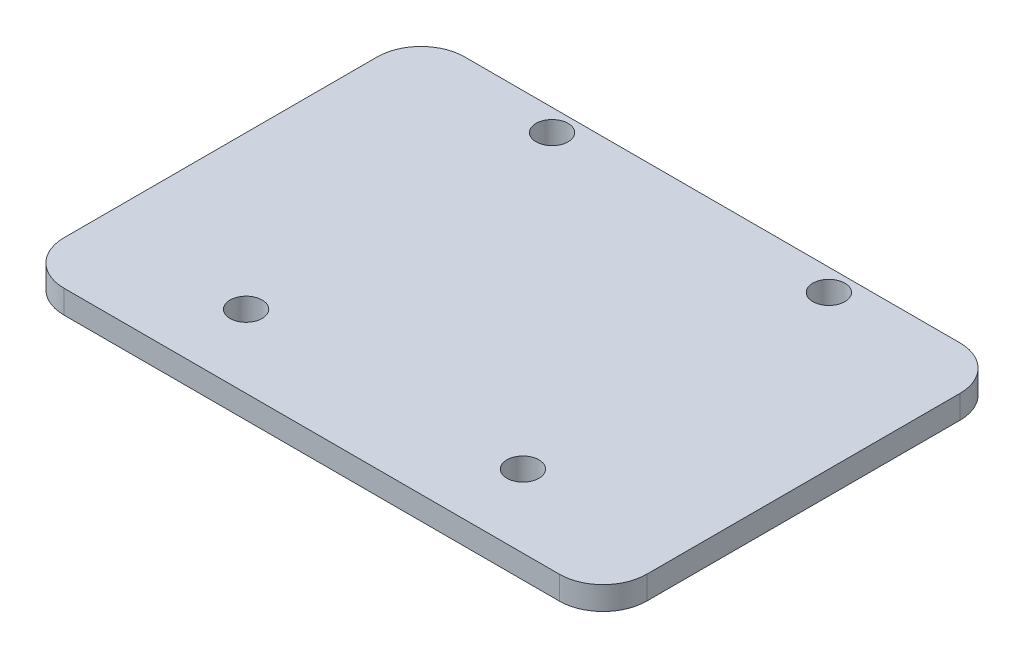
from build123d import *

# Parameters (mm, degrees)
SKETCH1_W                = 40
SKETCH1_H                = 27.5
BOSS_EXTRUDE1_DEPTH      = 1.6
M2_CLEARANCE_HOLE1_D     = 2.2
M2_CLEARANCE_HOLE1_DEPTH = 5.2
M2_CLEARANCE_HOLE1_TIP   = 0.660946681
FILLET1_R                = 3


with BuildPart() as part:
    # Sketch1 → Boss-Extrude1 (new body)
    with BuildSketch(Plane(origin=(0, 0, 0), x_dir=(1, 0, 0), z_dir=(0, 1, 0))):
        Rectangle(SKETCH1_W, SKETCH1_H)
    extrude(amount=BOSS_EXTRUDE1_DEPTH)

    # M2 Clearance Hole1
    with Locations(Plane(origin=(0, 1.6, 0), x_dir=(1, 0, 0), z_dir=(0, 1, 0))):
        with Locations((-9.5, 12.25), (9.5, 12.25), (9.5, -8.75), (-9.5, -8.75)):
            Hole(M2_CLEARANCE_HOLE1_D / 2, depth=M2_CLEARANCE_HOLE1_DEPTH)
            with Locations((0, 0, -(M2_CLEARANCE_HOLE1_DEPTH + M2_CLEARANCE_HOLE1_TIP / 2))):  # 118° drill point
                Cone(0, M2_CLEARANCE_HOLE1_D / 2, M2_CLEARANCE_HOLE1_TIP, mode=Mode.SUBTRACT)

    # Fillet1
    fillet1_edges = [part.edges().sort_by_distance(p)[0] for p in [
        (20, 0.8, -13.75),
        (20, 0.8, 13.75),
        (-20, 0.8, 13.75),
        (-20, 0.8, -13.75),
    ]]
    fillet(fillet1_edges, radius=FILLET1_R)


solid = part.part
